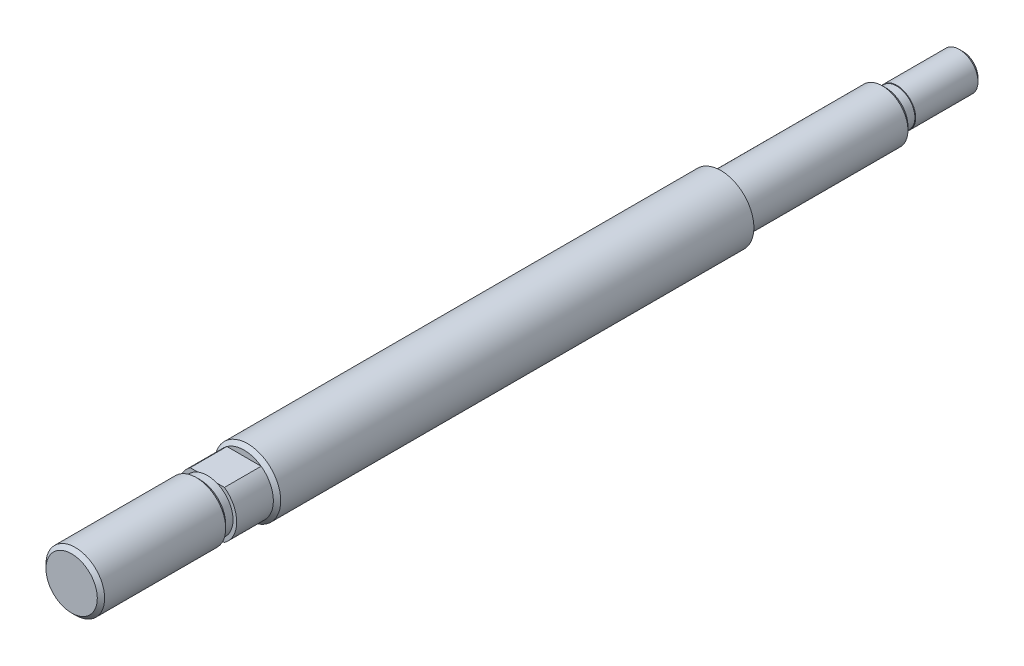
from build123d import *

# Parameters (mm, degrees)
SKETCH1_R           = 9
BOSS_EXTRUDE1_DEPTH = 121.5
SKETCH2_OUTSIDE_W   = 68.866
SKETCH2_OUTSIDE_H   = 68.866
SKETCH2_OUTSIDE_R   = 5.1
CUT_EXTRUDE2_DEPTH  = 19
SKETCH3_OUTSIDE_W   = 68.866
SKETCH3_OUTSIDE_H   = 68.866
SKETCH3_OUTSIDE_R   = 5
CUT_EXTRUDE3_DEPTH  = 2
SKETCH4_OUTSIDE_W   = 68.866
SKETCH4_OUTSIDE_H   = 68.866
SKETCH4_OUTSIDE_R   = 7
CUT_EXTRUDE4_DEPTH  = 45
CHAMFER1_SIZE       = 1
SKETCH5_OUTSIDE_W   = 68.866
SKETCH5_OUTSIDE_H   = 68.866
SKETCH5_OUTSIDE_R   = 6.5
CUT_EXTRUDE5_DEPTH  = 47
SKETCH6_R           = 8
BOSS_EXTRUDE2_DEPTH = 10
BOSS_EXTRUDE3_START = -35
SKETCH8_R           = 8
BOSS_EXTRUDE3_DEPTH = 35
CHAMFER3_SIZE       = 1
BOSS_EXTRUDE4_REACH = 210.389
SKETCH12_R          = 7
SKETCH14_W          = 10
SKETCH14_H          = 1.5
CUT_EXTRUDE7_DEPTH  = 17.5


# Some blends are built 0.0001 mm under size
with BuildPart() as part:
    # Sketch1 → Boss-Extrude1 (new, symmetric)
    with BuildSketch(Plane.XY):
        Circle(SKETCH1_R)
    extrude(amount=BOSS_EXTRUDE1_DEPTH, both=True)

    # Sketch2 outside → Cut-Extrude2 (cut)
    with BuildSketch(Plane(origin=(0, 0, -121.5), x_dir=(-1, 0, 0), z_dir=(0, 0, -1))):
        Rectangle(SKETCH2_OUTSIDE_W, SKETCH2_OUTSIDE_H)
        Circle(SKETCH2_OUTSIDE_R, mode=Mode.SUBTRACT)
    extrude(amount=-CUT_EXTRUDE2_DEPTH, mode=Mode.SUBTRACT)

    # Sketch3 outside → Cut-Extrude3 (cut)
    with BuildSketch(Plane(origin=(0, 0, -102.5), x_dir=(-1, 0, 0), z_dir=(0, 0, -1))):
        Rectangle(SKETCH3_OUTSIDE_W, SKETCH3_OUTSIDE_H)
        Circle(SKETCH3_OUTSIDE_R, mode=Mode.SUBTRACT)
    extrude(amount=-CUT_EXTRUDE3_DEPTH, mode=Mode.SUBTRACT)

    # Sketch4 outside → Cut-Extrude4 (cut)
    with BuildSketch(Plane(origin=(0, 0, -100.5), x_dir=(-1, 0, 0), z_dir=(0, 0, -1))):
        Rectangle(SKETCH4_OUTSIDE_W, SKETCH4_OUTSIDE_H)
        Circle(SKETCH4_OUTSIDE_R, mode=Mode.SUBTRACT)
    extrude(amount=-CUT_EXTRUDE4_DEPTH, mode=Mode.SUBTRACT)

    # Chamfer1
    # the kernel refuses this chamfer: 1 mm, written as the material it takes off along each edge
    with BuildSketch(Plane(origin=(0, 0, -100.5), x_dir=(-1, 0, 0), z_dir=(0, -1, 0))) as chamfer1_piece_1:
        Polygon((7, -CHAMFER1_SIZE), (7 - CHAMFER1_SIZE, 0), (7, 0), align=None)
    revolve(axis=Axis((0, 0, -100.5), (0, 0, -1)), mode=Mode.SUBTRACT)
    with BuildSketch(Plane(origin=(0, 0, -102.5), x_dir=(-1, 0, 0), z_dir=(0, -1, 0))) as chamfer1_piece_2_section:
        Polygon((5.1 - CHAMFER1_SIZE, 0), (5.1, CHAMFER1_SIZE), (5.1, 0), align=None)
    chamfer1_piece_2 = revolve(axis=Axis((0, 0, -102.5), (0, 0, -1)), mode=Mode.PRIVATE)
    chamfer1_piece_2 = chamfer1_piece_2 - Plane(origin=(0, 0, -103.453026439), x_dir=(-1, 0, 0), z_dir=(0, 0, -1)) * Cylinder(5, 21, mode=Mode.PRIVATE)
    add(chamfer1_piece_2, mode=Mode.SUBTRACT)
    with BuildSketch(Plane(origin=(0, 0, -121.5), x_dir=(-1, 0, 0), z_dir=(0, -1, 0))) as chamfer1_piece_3:
        Polygon((5.1, -CHAMFER1_SIZE), (5.1 - CHAMFER1_SIZE, 0), (5.1, 0), align=None)
    revolve(axis=Axis((0, 0, -121.5), (0, 0, -1)), mode=Mode.SUBTRACT)

    # Sketch5 outside → Cut-Extrude5 (cut)
    with BuildSketch(Plane.XY.offset(121.5)):
        Rectangle(SKETCH5_OUTSIDE_W, SKETCH5_OUTSIDE_H)
        Circle(SKETCH5_OUTSIDE_R, mode=Mode.SUBTRACT)
    extrude(amount=-CUT_EXTRUDE5_DEPTH, mode=Mode.SUBTRACT)

    # Sketch6 → Boss-Extrude2 (add)
    with BuildSketch(Plane.XY.offset(74.5)):
        Circle(SKETCH6_R)
    extrude(amount=BOSS_EXTRUDE2_DEPTH)

    # Sketch8 → Boss-Extrude3 (add)
    with BuildSketch(Plane.XY.offset(121.5).offset(BOSS_EXTRUDE3_START)):
        Circle(SKETCH8_R)
    extrude(amount=BOSS_EXTRUDE3_DEPTH)

    # Chamfer3
    chamfer3_edges = [part.edges().sort_by_distance(p)[0] for p in [
        (-9, 0, 74.5),
        (-8, 0, 86.5),
        (-8, 0, 121.5),
    ]]
    chamfer(chamfer3_edges, length=CHAMFER3_SIZE - 0.0001)  # a hair under: the kernel refuses the full size

    # Sketch12 → Boss-Extrude4 (add, up to next)
    with BuildSketch(Plane(origin=(0, 0, 86.5), x_dir=(-1, 0, 0), z_dir=(0, 0, -1)), mode=Mode.PRIVATE) as boss_extrude4_sk1:
        Circle(SKETCH12_R)
    boss_extrude4_tool1 = extrude(boss_extrude4_sk1.sketch, amount=BOSS_EXTRUDE4_REACH, mode=Mode.PRIVATE) - part.part
    add(boss_extrude4_tool1.solids().sort_by_distance((0, 0, 86.5))[0])

    # Sketch14 → Cut-Extrude7 (cut, symmetric)
    with BuildSketch(Plane(origin=(0, 0, 0), x_dir=(0, 0, -1), z_dir=(1, 0, 0))):
        with Locations((-79.5, 7.25)):
            Rectangle(SKETCH14_W, SKETCH14_H)
        with Locations((-79.5, -7.25)):
            Rectangle(SKETCH14_W, SKETCH14_H)
    extrude(amount=CUT_EXTRUDE7_DEPTH, both=True, mode=Mode.SUBTRACT)


solid = part.part
